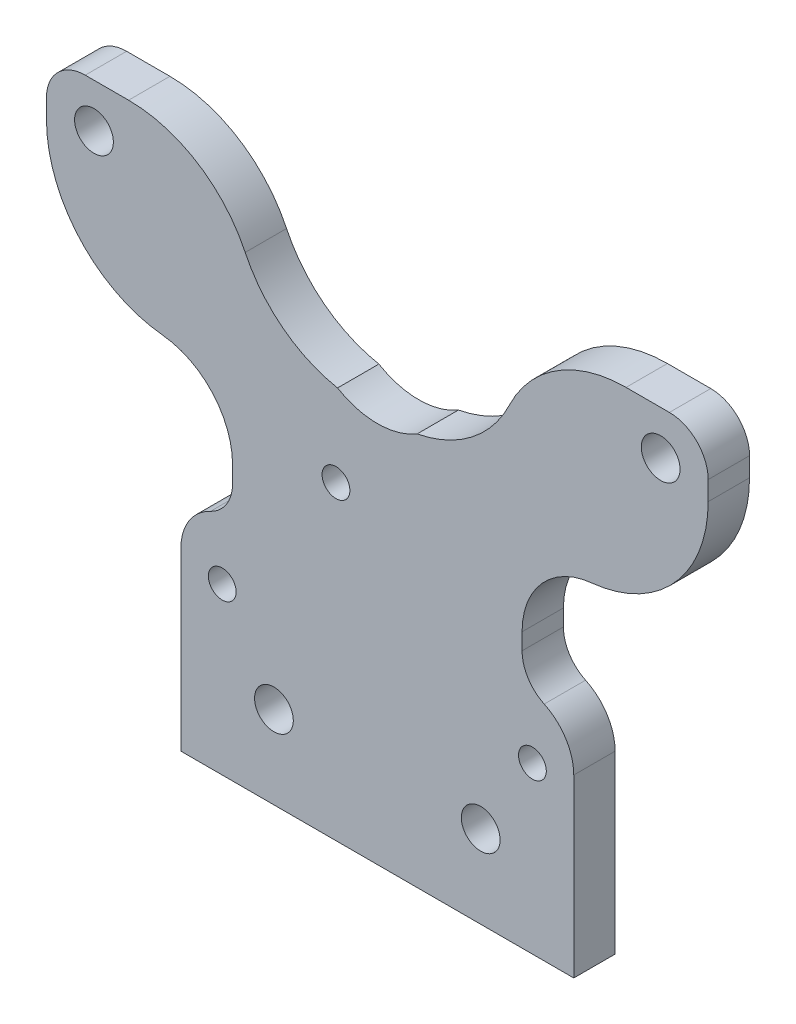
from build123d import *

# Parameters (mm, degrees)
SKETCH1_W           = 30.4
SKETCH1_H           = 3.2
BOSS_EXTRUDE1_DEPTH = 17.6
SKETCH2_R           = 1.5
CUT_EXTRUDE1_DEPTH  = 16
SKETCH3_R           = 1.075
CUT_EXTRUDE2_DEPTH  = 16
SKETCH4_W           = 22.4
SKETCH4_H           = 3.2
BOSS_EXTRUDE2_DEPTH = 12.8
SKETCH5_R           = 1.075
CUT_EXTRUDE3_DEPTH  = 16
SKETCH6_W           = 14.4
SKETCH6_H           = 14.4
BOSS_EXTRUDE3_DEPTH = 3.2
SKETCH7_R           = 1.5
CUT_EXTRUDE4_DEPTH  = 59.356147919
SKETCH8_R           = 6
CUT_EXTRUDE5_DEPTH  = 3.2
FILLET5_R           = 4
FILLET6_R           = 10
FILLET7_R           = 6
FILLET8_R           = 10
FILLET9_R           = 3
FILLET10_R          = 10
FILLET12_R          = 3


# Some blends are built 0.0001 mm under size
with BuildPart() as part:
    # Sketch1 → Boss-Extrude1 (new body)
    with BuildSketch(Plane(origin=(0, 0, 0), x_dir=(1, 0, 0), z_dir=(0, 1, 0))):
        with Locations((15.2, -1.6)):
            Rectangle(SKETCH1_W, SKETCH1_H)
    extrude(amount=BOSS_EXTRUDE1_DEPTH)

    # Sketch2 → Cut-Extrude1 (cut)
    with BuildSketch(Plane.XY.offset(3.2)):
        with Locations((23.2, 6.4)):
            Circle(SKETCH2_R)
        with Locations((7.2, 6.4)):
            Circle(SKETCH2_R)
    extrude(amount=-CUT_EXTRUDE1_DEPTH, mode=Mode.SUBTRACT)

    # Sketch3 → Cut-Extrude2 (cut)
    with BuildSketch(Plane(origin=(0, 0, 0), x_dir=(-1, 0, 0), z_dir=(0, 0, -1))):
        with Locations((-27.2, 12.8)):
            Circle(SKETCH3_R)
        with Locations((-3.2, 12.8)):
            Circle(SKETCH3_R)
    extrude(amount=-CUT_EXTRUDE2_DEPTH, mode=Mode.SUBTRACT)

    # Sketch4 → Boss-Extrude2 (add)
    with BuildSketch(Plane(origin=(0, 17.6, 0), x_dir=(1, 0, 0), z_dir=(0, 1, 0))):
        with Locations((15.2, -1.6)):
            Rectangle(SKETCH4_W, SKETCH4_H)
    extrude(amount=BOSS_EXTRUDE2_DEPTH)

    # Sketch5 → Cut-Extrude3 (cut)
    with BuildSketch(Plane.XY.offset(3.2)):
        with Locations((12, 24)):
            Circle(SKETCH5_R)
    extrude(amount=-CUT_EXTRUDE3_DEPTH, mode=Mode.SUBTRACT)

    # Sketch6 → Boss-Extrude3 (add)
    with BuildSketch(Plane.XY.offset(3.2)):
        with Locations((-3.2, 34.4)):
            Rectangle(SKETCH6_W, SKETCH6_H)
        with Locations((33.6, 34.4)):
            Rectangle(SKETCH6_W, SKETCH6_H)
    extrude(amount=-BOSS_EXTRUDE3_DEPTH)

    # Sketch7 → Cut-Extrude4 (cut, through all)
    with BuildSketch(Plane.XY.offset(3.2)):
        with Locations((-6.725, 38.2)):
            Circle(SKETCH7_R)
        with Locations((37.125, 38.2)):
            Circle(SKETCH7_R)
    extrude(amount=-CUT_EXTRUDE4_DEPTH, mode=Mode.SUBTRACT)

    # Sketch8 → Cut-Extrude5 (cut)
    with BuildSketch(Plane.XY.offset(3.2)):
        with Locations((15.2, 35.549818305)):
            Circle(SKETCH8_R)
    extrude(amount=-CUT_EXTRUDE5_DEPTH, mode=Mode.SUBTRACT)

    # Fillet5
    fillet5_edges = [part.edges().sort_by_distance(p)[0] for p in [
        (0, 17.6, 1.6),
        (30.4, 17.6, 1.6),
    ]]
    fillet(fillet5_edges, radius=FILLET5_R - 0.0001)  # a hair under: the kernel refuses the full size

    # Fillet6
    # the kernel refuses this fillet: 10 mm, written as the material it adds along each edge
    with BuildSketch(Plane(origin=(26.4, 30.4, 3.2), x_dir=(0, 1, 0), z_dir=(0, 0, -1)), Plane(origin=(4, 30.4, 0), x_dir=(0, 1, 0), z_dir=(0, 0, 1))) as fillet6_piece_1:
        with BuildLine():
            CenterArc((9.821908657, -10), FILLET6_R, 90, 79.170567871)
            Line((0, -8.121141214), (-0.196438173, -8.083564039))
            ThreePointArc((-0.196438173, -8.083564039), (-0.2, -4.060570607), (-0.2, 0))
            Line((-0.2, 0), (0, 0.2))
            Line((0, 0.2), (9.821908657, 0.2))
            Line((9.821908657, 0.2), (9.821908657, 0))
        make_face()
    extrude(amount=3.2)

    # Fillet7
    fillet7_edges = [part.edges().sort_by_distance(p)[0] for p in [
        (4, 27.2, 1.6),
        (26.4, 27.2, 1.6),
    ]]
    fillet(fillet7_edges, radius=FILLET7_R)

    # Fillet8
    fillet8_edges = [part.edges().sort_by_distance(p)[0] for p in [
        (40.8, 27.2, 1.6),
        (-10.4, 27.2, 1.6),
    ]]
    fillet(fillet8_edges, radius=FILLET8_R)

    # Fillet9
    fillet9_edges = [part.edges().sort_by_distance(p)[0] for p in [
        (-10.4, 41.6, 1.6),
        (40.8, 41.6, 1.6),
    ]]
    fillet(fillet9_edges, radius=FILLET9_R)

    # Fillet10
    fillet10_edges = [part.edges().sort_by_distance(p)[0] for p in [
        (26.4, 41.6, 1.6),
        (4, 41.6, 1.6),
    ]]
    fillet(fillet10_edges, radius=FILLET10_R)

    # Fillet12
    fillet12_edges = [part.edges().sort_by_distance(p)[0] for p in [
        (4, 17.6, 1.6),
        (26.4, 17.6, 1.6),
    ]]
    fillet(fillet12_edges, radius=FILLET12_R)


solid = part.part
